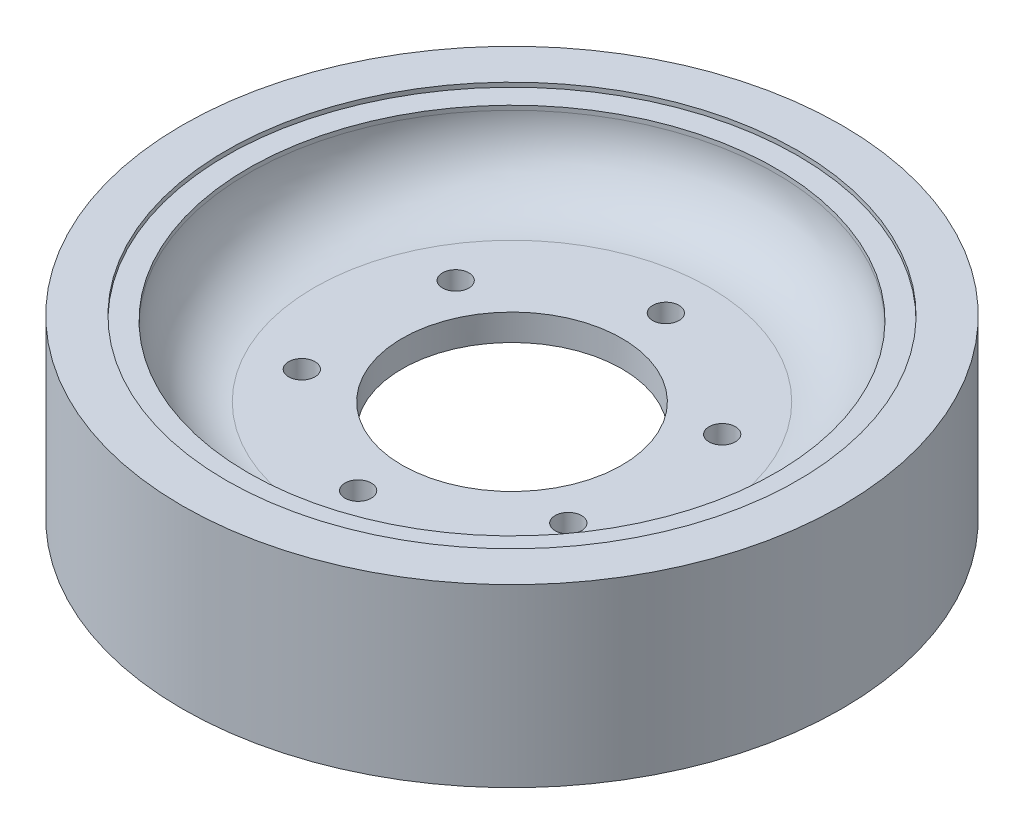
from build123d import *

# Parameters (mm, degrees)
SKETCH1_R           = 75
BOSS_EXTRUDE1_DEPTH = 40
SKETCH2_R           = 60
CUT_EXTRUDE1_DEPTH  = 17
SKETCH3_R           = 25
CUT_EXTRUDE2_DEPTH  = 109.531101533
SKETCH4_R           = 3
CUT_EXTRUDE3_DEPTH  = 109.531101533
CUT_EXTRUDE4_START  = -17
SKETCH6_R           = 60
CUT_EXTRUDE4_DEPTH  = 17
SKETCH7_R           = 65
CUT_EXTRUDE5_DEPTH  = 1
CUT_EXTRUDE6_START  = -1
SKETCH8_R           = 65
CUT_EXTRUDE6_DEPTH  = 1
FILLET1_R           = 15
FILLET2_R           = 15


with BuildPart() as part:
    # Sketch1 → Boss-Extrude1 (new body)
    with BuildSketch(Plane(origin=(0, 0, 0), x_dir=(1, 0, 0), z_dir=(0, 1, 0))):
        Circle(SKETCH1_R)
    extrude(amount=BOSS_EXTRUDE1_DEPTH)

    # Sketch2 → Cut-Extrude1 (cut)
    with BuildSketch(Plane(origin=(0, 40, 0), x_dir=(1, 0, 0), z_dir=(0, 1, 0))):
        Circle(SKETCH2_R)
    extrude(amount=-CUT_EXTRUDE1_DEPTH, mode=Mode.SUBTRACT)

    # Sketch3 → Cut-Extrude2 (cut, through all)
    with BuildSketch(Plane(origin=(0, 23, 0), x_dir=(1, 0, 0), z_dir=(0, 1, 0))):
        Circle(SKETCH3_R)
    extrude(amount=-CUT_EXTRUDE2_DEPTH, mode=Mode.SUBTRACT)

    # Sketch4 → Cut-Extrude3 (cut, through all)
    with BuildSketch(Plane(origin=(0, 23, 0), x_dir=(1, 0, 0), z_dir=(0, 1, 0))):
        with Locations((0, 35)):
            Circle(SKETCH4_R)
        with Locations((30.310889132, 17.5)):
            Circle(SKETCH4_R)
        with Locations((30.310889132, -17.5)):
            Circle(SKETCH4_R)
        with Locations((0, -35)):
            Circle(SKETCH4_R)
        with Locations((-30.310889132, -17.5)):
            Circle(SKETCH4_R)
        with Locations((-30.310889132, 17.5)):
            Circle(SKETCH4_R)
    extrude(amount=-CUT_EXTRUDE3_DEPTH, mode=Mode.SUBTRACT)

    # Sketch6 → Cut-Extrude4 (cut)
    with BuildSketch(Plane.XZ.offset(CUT_EXTRUDE4_START)):
        Circle(SKETCH6_R)
    extrude(amount=CUT_EXTRUDE4_DEPTH, mode=Mode.SUBTRACT)

    # Sketch7 → Cut-Extrude5 (cut)
    with BuildSketch(Plane.XZ):
        Circle(SKETCH7_R)
    extrude(amount=-CUT_EXTRUDE5_DEPTH, mode=Mode.SUBTRACT)

    # Sketch8 → Cut-Extrude6 (cut)
    with BuildSketch(Plane(origin=(0, 40, 0), x_dir=(1, 0, 0), z_dir=(0, 1, 0)).offset(CUT_EXTRUDE6_START)):
        Circle(SKETCH8_R)
    extrude(amount=CUT_EXTRUDE6_DEPTH, mode=Mode.SUBTRACT)

    # Fillet1
    fillet1_edges = [part.edges().sort_by_distance(p)[0] for p in [
        (-60, 23, 0),
    ]]
    fillet(fillet1_edges, radius=FILLET1_R)

    # Fillet2
    fillet2_edges = [part.edges().sort_by_distance(p)[0] for p in [
        (-60, 17, 0),
    ]]
    fillet(fillet2_edges, radius=FILLET2_R)


solid = part.part
